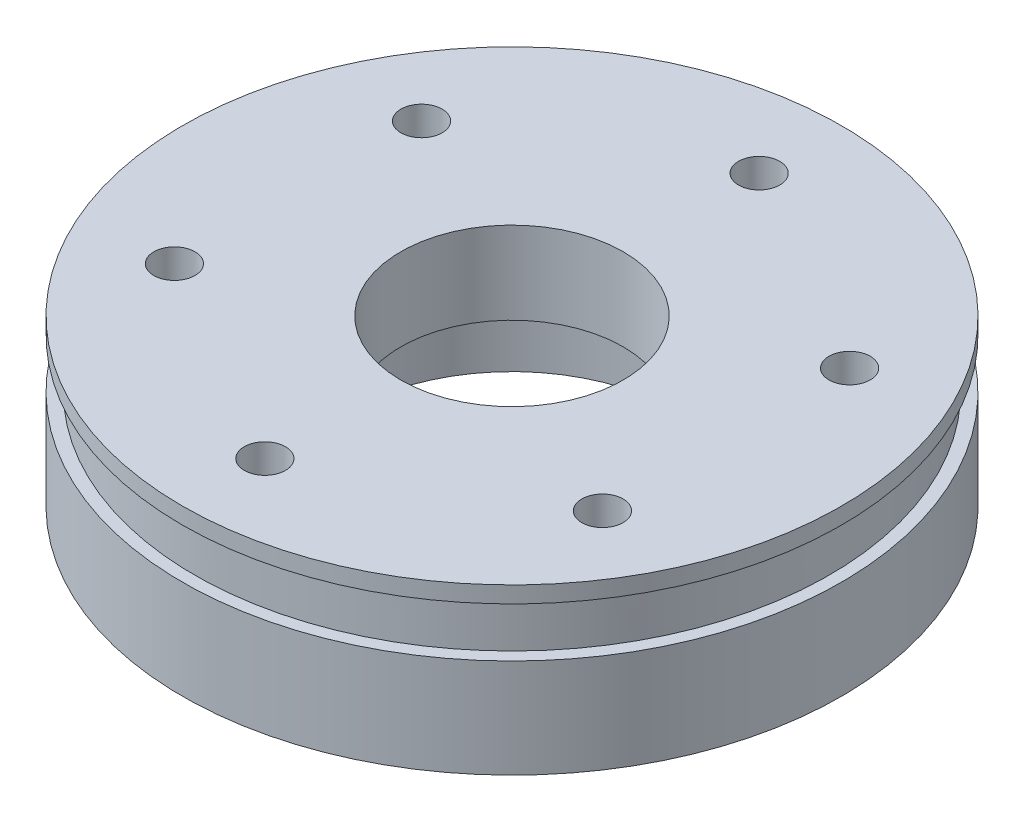
from build123d import *

# Parameters (mm, degrees)
SKETCH1_R                = 38.515
BOSS_EXTRUDE1_DEPTH      = 10
SKETCH2_R                = 40
BOSS_EXTRUDE2_DEPTH      = 2
BOSS_EXTRUDE3_DEPTH      = 10
BOSS_EXTRUDE3_DEPTH_BACK = 2
SKETCH3_R                = 40
SKETCH4_R                = 13.5
SKETCH4_R_2              = 2.5
CUT_EXTRUDE1_DEPTH       = 61
SKETCH5_R                = 20
CUT_EXTRUDE2_DEPTH       = 10


with BuildPart() as part:
    # Sketch1 → Boss-Extrude1 (new body)
    with BuildSketch(Plane(origin=(0, 0, 0), x_dir=(1, 0, 0), z_dir=(0, 1, 0))):
        Circle(SKETCH1_R)
    extrude(amount=BOSS_EXTRUDE1_DEPTH)

    # Sketch2 → Boss-Extrude2 (add)
    with BuildSketch(Plane(origin=(0, 10, 0), x_dir=(1, 0, 0), z_dir=(0, 1, 0))):
        Circle(SKETCH2_R)
    extrude(amount=-BOSS_EXTRUDE2_DEPTH)

    # Sketch3 → Boss-Extrude3 (add, two sides: drawn at the far end of the back side and taken through both)
    with BuildSketch(Plane.XZ.offset(-BOSS_EXTRUDE3_DEPTH_BACK)):
        Circle(SKETCH3_R)
    extrude(amount=BOSS_EXTRUDE3_DEPTH + BOSS_EXTRUDE3_DEPTH_BACK)

    # Sketch4 → Cut-Extrude1 (cut, through all)
    with BuildSketch(Plane.XZ.offset(10)):
        Circle(SKETCH4_R)
        with Locations((0, 30)):
            Circle(SKETCH4_R_2)
        with Locations((25.980762114, 15)):
            Circle(SKETCH4_R_2)
        with Locations((25.980762114, -15)):
            Circle(SKETCH4_R_2)
        with Locations((0, -30)):
            Circle(SKETCH4_R_2)
        with Locations((-25.980762114, -15)):
            Circle(SKETCH4_R_2)
        with Locations((-25.980762114, 15)):
            Circle(SKETCH4_R_2)
    extrude(amount=-CUT_EXTRUDE1_DEPTH, mode=Mode.SUBTRACT)

    # Sketch5 → Cut-Extrude2 (cut)
    with BuildSketch(Plane.XZ.offset(10)):
        Circle(SKETCH5_R)
    extrude(amount=-CUT_EXTRUDE2_DEPTH, mode=Mode.SUBTRACT)


solid = part.part
